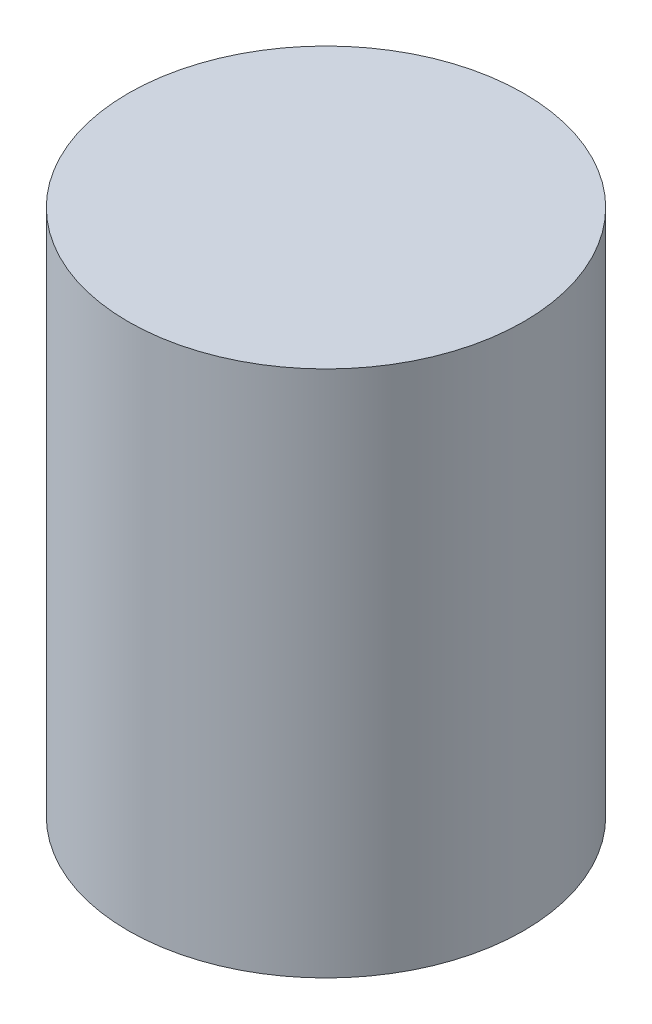
from build123d import *

# Parameters (mm, degrees)
SKETCH_1_R          = 1.5
EXTRUDE_1_DEPTH     = 4
CUT_EXTRUDE_1_DEPTH = 2


with BuildPart() as part:
    # 草图1 → 凸台-拉伸1 (new body)
    with BuildSketch(Plane(origin=(0, 0, 0), x_dir=(1, 0, 0), z_dir=(0, 1, 0))):
        Circle(SKETCH_1_R)
    extrude(amount=EXTRUDE_1_DEPTH)

    # 草图2 → 切除-拉伸1 (cut)
    with BuildSketch(Plane.XZ):
        Polygon((0.694435065, -0.517455255), (0.795346928, 0.34267078), (0.100911863, 0.860126035), (-0.694435065, 0.517455255), (-0.795346928, -0.34267078), (-0.100911863, -0.860126035), align=None)
    extrude(amount=-CUT_EXTRUDE_1_DEPTH, mode=Mode.SUBTRACT)


solid = part.part
